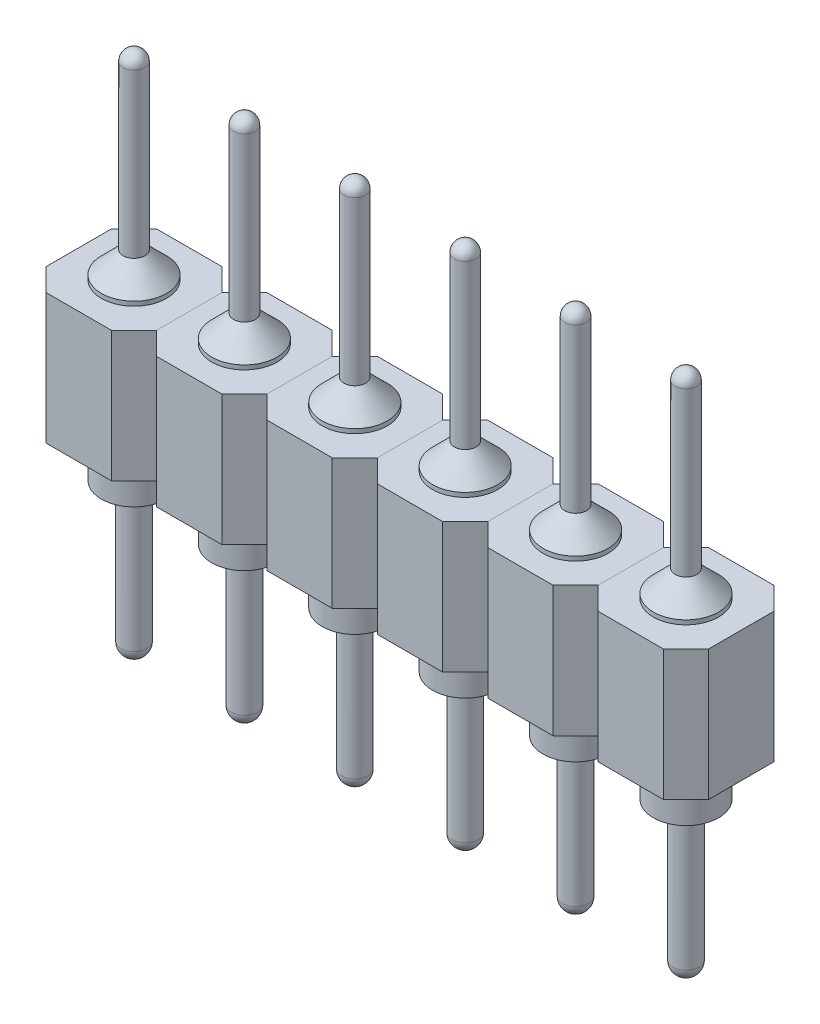
from build123d import *
from build123d.topology import SkipClean

# Parameters (mm, degrees)
EXTRUDE_START          = -1
SKETCH_3_R             = 0.75
EXTRUDE_1_DEPTH        = 3
PATTERN_LINEAR_1_COUNT = 6
PATTERN_LINEAR_1_PITCH = 2.54


with BuildPart() as part:
    # Эскиз2 → Повернуть1 (revolve)
    with SkipClean():  # the faces are left unmerged after this step: merging them gives an invalid solid
        with BuildSketch(Plane.XY):
            with BuildLine():
                Line((0, 11.6), (0, 0.6))
                ThreePointArc((0, 0.6), (0.212132034, 0.512132034), (0.3, 0.3))
                Line((0.3, 0.3), (0.3, 3.5))
                Line((0.3, 3.5), (0.75, 3.5))
                Line((0.75, 3.5), (0.75, 7.6))
                Line((0.75, 7.6), (0.25, 8.1))
                Line((0.25, 8.1), (0.25, 11.85))
                ThreePointArc((0.25, 11.85), (0.176776695, 11.673223305), (0, 11.6))
            make_face()
            with BuildLine():
                ThreePointArc((0, 0.6), (-0.3, 0.3), (0, 0))
                Line((0, 0), (0, 0.6))
            make_face()
            with BuildLine():
                Line((0, 0.6), (0, 0))
                ThreePointArc((0, 0), (0.212132034, 0.087867966), (0.3, 0.3))
                ThreePointArc((0.3, 0.3), (0.212132034, 0.512132034), (0, 0.6))
            make_face()
            with BuildLine():
                ThreePointArc((0, 12.1), (-0.25, 11.85), (0, 11.6))
                Line((0, 11.6), (0, 12.1))
            make_face()
            with BuildLine():
                Line((0, 12.1), (0, 11.6))
                ThreePointArc((0, 11.6), (0.176776695, 11.673223305), (0.25, 11.85))
                ThreePointArc((0.25, 11.85), (0.176776695, 12.026776695), (0, 12.1))
            make_face()
        revolve(axis=Axis((0, 0, 0), (0, 1, 0)))
    add(part.part.scale(1), mode=Mode.REPLACE)  # the faces are merged on a copy


with BuildPart() as body_2:
    # Эскиз3 → Бобышка-Вытянуть1 (new body)
    with BuildSketch(Plane.XZ.offset(-3.5).offset(EXTRUDE_START)):
        Polygon((-0.75, 1.27), (0.75, 1.27), (1.27, 0.75), (1.27, -0.75), (0.75, -1.27), (-0.75, -1.27), (-1.27, -0.75), (-1.27, 0.75), align=None)
        Circle(SKETCH_3_R, mode=Mode.SUBTRACT)
    extrude(amount=-EXTRUDE_1_DEPTH)


with BuildPart() as pattern_linear_1_1:
    # Линейный массив1: pattern copy
    add(body_2.part.moved(Location(Vector(-1, 0, 0) * (1 * PATTERN_LINEAR_1_PITCH))))


with BuildPart() as pattern_linear_1_2:
    # Линейный массив1: pattern copy
    add(body_2.part.moved(Location(Vector(-1, 0, 0) * (2 * PATTERN_LINEAR_1_PITCH))))


with BuildPart() as pattern_linear_1_3:
    # Линейный массив1: pattern copy
    add(body_2.part.moved(Location(Vector(-1, 0, 0) * (3 * PATTERN_LINEAR_1_PITCH))))


with BuildPart() as pattern_linear_1_4:
    # Линейный массив1: pattern copy
    add(body_2.part.moved(Location(Vector(-1, 0, 0) * (4 * PATTERN_LINEAR_1_PITCH))))


with BuildPart() as pattern_linear_1_5:
    # Линейный массив1: pattern copy
    add(body_2.part.moved(Location(Vector(-1, 0, 0) * (5 * PATTERN_LINEAR_1_PITCH))))


with BuildPart() as pattern_linear_1_6:
    # Линейный массив1: pattern copy
    add(part.part.moved(Location(Vector(-1, 0, 0) * (1 * PATTERN_LINEAR_1_PITCH))))


with BuildPart() as pattern_linear_1_7:
    # Линейный массив1: pattern copy
    add(part.part.moved(Location(Vector(-1, 0, 0) * (2 * PATTERN_LINEAR_1_PITCH))))


with BuildPart() as pattern_linear_1_8:
    # Линейный массив1: pattern copy
    add(part.part.moved(Location(Vector(-1, 0, 0) * (3 * PATTERN_LINEAR_1_PITCH))))


with BuildPart() as pattern_linear_1_9:
    # Линейный массив1: pattern copy
    add(part.part.moved(Location(Vector(-1, 0, 0) * (4 * PATTERN_LINEAR_1_PITCH))))


with BuildPart() as pattern_linear_1_10:
    # Линейный массив1: pattern copy
    add(part.part.moved(Location(Vector(-1, 0, 0) * (5 * PATTERN_LINEAR_1_PITCH))))


solid = Compound([part.part, body_2.part, pattern_linear_1_1.part, pattern_linear_1_2.part, pattern_linear_1_3.part, pattern_linear_1_4.part, pattern_linear_1_5.part, pattern_linear_1_6.part, pattern_linear_1_7.part, pattern_linear_1_8.part, pattern_linear_1_9.part, pattern_linear_1_10.part])
